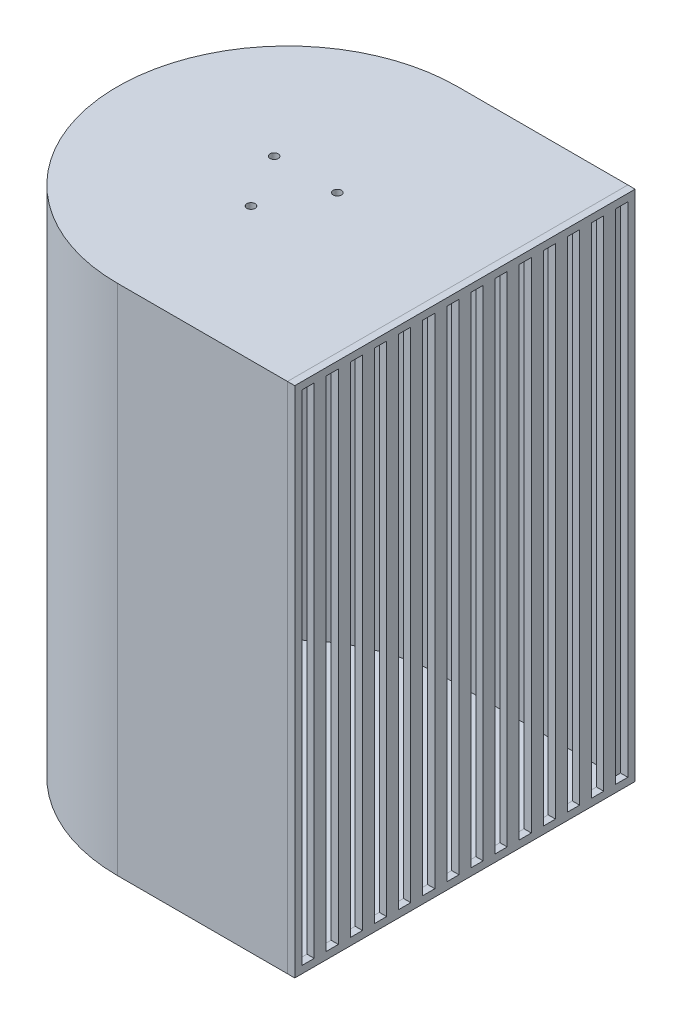
from build123d import *

# Parameters (mm, degrees)
SKETCH1_R                     = 70
BOSS_EXTRUDE1_DEPTH           = 3
BOSS_EXTRUDE2_START           = 205
SKETCH4_R                     = 70
SKETCH4_R_2                   = 65
BOSS_EXTRUDE2_DEPTH           = 205
BOSS_EXTRUDE3_START           = 3
SKETCH5_R                     = 70
BOSS_EXTRUDE3_DEPTH           = 3
BODY_DELETE_KEEP_START        = -208
BODY_DELETE_KEEP_1_DEPTH      = 211
SKETCH6_W                     = 211
SKETCH6_H                     = 140
SKETCH6_W_2                   = 205
SKETCH6_H_2                   = 130
BOSS_EXTRUDE4_DEPTH           = 70
SKETCH7_W                     = 211
SKETCH7_H                     = 140
BOSS_EXTRUDE5_DEPTH           = 3
SKETCH8_W                     = 205
SKETCH8_H                     = 5
CUT_EXTRUDE1_DEPTH            = 3
M3_CLEARANCE_HOLE1_AT_2_COUNT = 2
M3_CLEARANCE_HOLE1_AT_2_PITCH = 25.980762114
M3_CLEARANCE_HOLE1_AT_3_COUNT = 2
M3_CLEARANCE_HOLE1_AT_3_PITCH = 25.980762114


# Read off the part's stored shape, not the designer's step: Body-Delete/Keep 1
with BuildPart() as part:
    # Sketch1 → Boss-Extrude1 (new body)
    with BuildSketch(Plane(origin=(0, 0, 0), x_dir=(-1, 0, 0), z_dir=(0, 1, 0))):
        with Locations(Location((0, 0, 0), (0, 0, 90))):
            Circle(SKETCH1_R)
    extrude(amount=BOSS_EXTRUDE1_DEPTH)

    # Sketch4 → Boss-Extrude2 (add)
    with BuildSketch(Plane.XZ.offset(BOSS_EXTRUDE2_START)):
        with Locations(Location((0, 0, 0), (0, 0, 270))):
            Circle(SKETCH4_R)
        with Locations(Location((0, 0, 0), (0, 0, 90))):
            Circle(SKETCH4_R_2, mode=Mode.SUBTRACT)
    extrude(amount=-BOSS_EXTRUDE2_DEPTH)

    # Sketch5 → Boss-Extrude3 (add)
    with BuildSketch(Plane.XZ.offset(205).offset(BOSS_EXTRUDE3_START)):
        with Locations(Location((0, 0, 0), (0, 0, 270))):
            Circle(SKETCH5_R)
    extrude(amount=-BOSS_EXTRUDE3_DEPTH)


with BuildPart() as body_2:
    # Split1: the piece on the far side of the plane
    add(part.part)
    split(bisect_by=Plane(origin=(0, 0, 0), x_dir=(0, 0, 1), z_dir=(1, 0, 0)), keep=Keep.BOTTOM)

    # Sketch6 → Boss-Extrude4 (add)
    with BuildSketch(Plane.YZ):
        with Locations((-102.5, 0)):
            Rectangle(SKETCH6_W, SKETCH6_H)
        with Locations((-102.5, 0)):
            Rectangle(SKETCH6_W_2, SKETCH6_H_2, mode=Mode.SUBTRACT)
    extrude(amount=BOSS_EXTRUDE4_DEPTH)

    # Sketch7 → Boss-Extrude5 (add)
    with BuildSketch(Plane.YZ.offset(70)):
        with Locations((-102.5, 0)):
            Rectangle(SKETCH7_W, SKETCH7_H)
    extrude(amount=BOSS_EXTRUDE5_DEPTH)

    # Sketch8 → Cut-Extrude1 (cut)
    with BuildSketch(Plane.YZ.offset(73)):
        with Locations((-102.5, 64.5)):
            Rectangle(SKETCH8_W, SKETCH8_H)
        with Locations((-102.5, 54.576923077)):
            Rectangle(SKETCH8_W, SKETCH8_H)
        with Locations((-102.5, 44.653846154)):
            Rectangle(SKETCH8_W, SKETCH8_H)
        with Locations((-102.5, 34.730769231)):
            Rectangle(SKETCH8_W, SKETCH8_H)
        with Locations((-102.5, 24.807692308)):
            Rectangle(SKETCH8_W, SKETCH8_H)
        with Locations((-102.5, 14.884615385)):
            Rectangle(SKETCH8_W, SKETCH8_H)
        with Locations((-102.5, 4.961538462)):
            Rectangle(SKETCH8_W, SKETCH8_H)
        with Locations((-102.5, -4.961538462)):
            Rectangle(SKETCH8_W, SKETCH8_H)
        with Locations((-102.5, -14.884615385)):
            Rectangle(SKETCH8_W, SKETCH8_H)
        with Locations((-102.5, -24.807692308)):
            Rectangle(SKETCH8_W, SKETCH8_H)
        with Locations((-102.5, -34.730769231)):
            Rectangle(SKETCH8_W, SKETCH8_H)
        with Locations((-102.5, -44.653846154)):
            Rectangle(SKETCH8_W, SKETCH8_H)
        with Locations((-102.5, -54.576923077)):
            Rectangle(SKETCH8_W, SKETCH8_H)
        with Locations((-102.5, -64.5)):
            Rectangle(SKETCH8_W, SKETCH8_H)
    extrude(amount=-CUT_EXTRUDE1_DEPTH, mode=Mode.SUBTRACT)


with BuildPart() as part_1:
    add(part.part)

    # Split1
    split(bisect_by=Plane(origin=(0, 0, 0), x_dir=(0, 0, 1), z_dir=(1, 0, 0)), keep=Keep.TOP)

    # Body-Delete/Keep 1 outline → Body-Delete/Keep 1 (cut)
    with BuildSketch(Plane(origin=(0, 0, 0), x_dir=(1, 0, 0), z_dir=(0, 1, 0)).offset(BODY_DELETE_KEEP_START)):
        with BuildLine():
            ThreePointArc((0, -70), (70, 0), (0, 70))
            Line((0, 70), (0, -70))
        make_face()
    extrude(amount=BODY_DELETE_KEEP_1_DEPTH, mode=Mode.SUBTRACT)


with BuildPart() as body_2_2:
    # Split2: the piece on the far side of the plane
    add(body_2.part)
    split(bisect_by=Plane(origin=(70, 0, 0), x_dir=(0, 0, 1), z_dir=(1, 0, 0)), keep=Keep.BOTTOM)

    # Sketch10 → M3 Clearance Hole1 (revolve, cut)
    with BuildSketch(Plane(origin=(12.990381057, 3, -7.5), x_dir=(0, 0, 1), z_dir=(1, 0, 0))):
        Polygon((0, 0), (0, 4.021463052), (1.7, 3), (1.7, 0), align=None)
    m3_clearance_hole1 = revolve(axis=Axis((12.990381057, 9.35, -7.5), (0, -1, 0)), mode=Mode.SUBTRACT)

    # M3 Clearance Hole1 at 2: M3 Clearance Hole1 ×2
    with Locations(*[Vector(-0.4999999999999635, 0, 0.8660254037844598) * (i * M3_CLEARANCE_HOLE1_AT_2_PITCH) for i in range(1, M3_CLEARANCE_HOLE1_AT_2_COUNT)]):
        add(m3_clearance_hole1, mode=Mode.SUBTRACT)

    # M3 Clearance Hole1 at 3: M3 Clearance Hole1 ×2
    with Locations(*[(-i * M3_CLEARANCE_HOLE1_AT_3_PITCH, 0, 0) for i in range(1, M3_CLEARANCE_HOLE1_AT_3_COUNT)]):
        add(m3_clearance_hole1, mode=Mode.SUBTRACT)


with BuildPart() as body_2_1:
    add(body_2.part)

    # Split2
    split(bisect_by=Plane(origin=(70, 0, 0), x_dir=(0, 0, 1), z_dir=(1, 0, 0)), keep=Keep.TOP)


solid = Compound([body_2_2.part, body_2_1.part])
